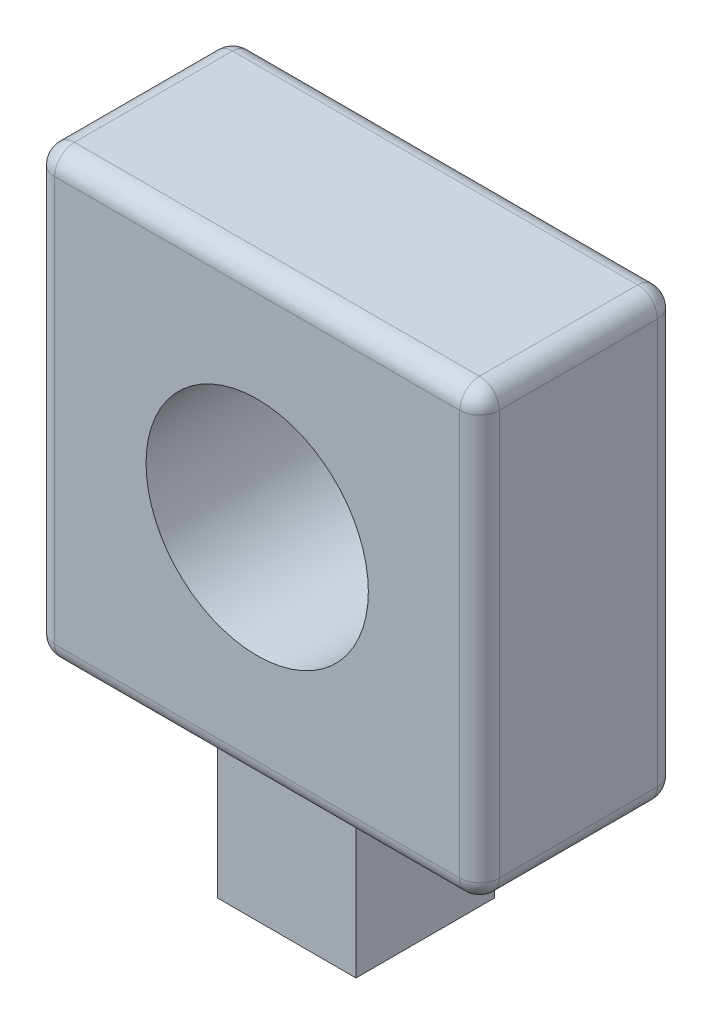
from build123d import *

# Parameters (mm, degrees)
BOSS_EXTRUDE1_DEPTH      = 12.7
BOSS_EXTRUDE1_DEPTH_BACK = 6.35
SKETCH1_W                = 17.78
SKETCH1_H                = 17.78
SKETCH2_W                = 57.15
SKETCH2_H                = 25.4
BOSS_EXTRUDE2_DEPTH      = 57.15
SKETCH3_R                = 14.2875
CUT_EXTRUDE1_DEPTH       = 80.628594895
FILLET1_R                = 2.54


with BuildPart() as part:
    # Sketch1 → Boss-Extrude1 (new, two sides: drawn at the far end of the back side and taken through both)
    with BuildSketch(Plane(origin=(0, 0, 0), x_dir=(1, 0, 0), z_dir=(0, 1, 0)).offset(-BOSS_EXTRUDE1_DEPTH_BACK)):
        Rectangle(SKETCH1_W, SKETCH1_H)
    extrude(amount=BOSS_EXTRUDE1_DEPTH + BOSS_EXTRUDE1_DEPTH_BACK)

    # Sketch2 → Boss-Extrude2 (add)
    with BuildSketch(Plane(origin=(0, 12.7, 0), x_dir=(1, 0, 0), z_dir=(0, 1, 0))):
        Rectangle(SKETCH2_W, SKETCH2_H)
    extrude(amount=BOSS_EXTRUDE2_DEPTH)

    # Sketch3 → Cut-Extrude1 (cut, through all)
    with BuildSketch(Plane.XY.offset(12.7)):
        with Locations((0, 41.275)):
            Circle(SKETCH3_R)
    extrude(amount=-CUT_EXTRUDE1_DEPTH, mode=Mode.SUBTRACT)

    # Fillet1
    fillet1_edges = [part.edges().sort_by_distance(p)[0] for p in [
        (28.575, 69.85, 0),
        (28.575, 12.7, 0),
        (-28.575, 69.85, 0),
        (-28.575, 12.7, 0),
        (28.575, 41.275, -12.7),
        (0, 69.85, -12.7),
        (-28.575, 41.275, -12.7),
        (0, 12.7, -12.7),
        (-28.575, 41.275, 12.7),
        (0, 69.85, 12.7),
        (28.575, 41.275, 12.7),
        (0, 12.7, 12.7),
    ]]
    fillet(fillet1_edges, radius=FILLET1_R)


solid = part.part
